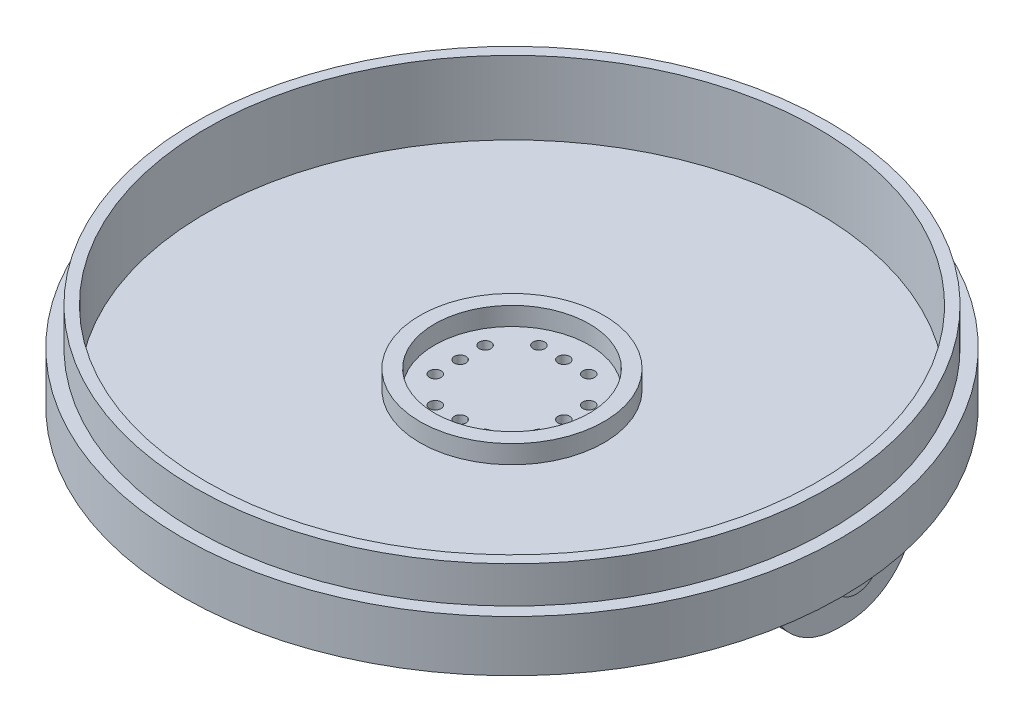
from build123d import *

# Parameters (mm, degrees)
CROQUIS2_R              = 45
SALIENTE_EXTRUIR1_DEPTH = 2
CROQUIS3_R              = 43.25
CROQUIS3_R_2            = 41.75
SALIENTE_EXTRUIR2_DEPTH = 10
CROQUIS4_R              = 45
CROQUIS4_R_2            = 43.25
SALIENTE_EXTRUIR3_DEPTH = 5
CROQUIS6_R              = 12.56
CROQUIS6_R_2            = 10.56
SALIENTE_EXTRUIR4_DEPTH = 2.5
CROQUIS7_R              = 0.8
CORTAR_EXTRUIR1_DEPTH   = 65.420493634
SALIENTE_EXTRUIR5_DEPTH = 6
CROQUIS10_R             = 1.45
SALIENTE_EXTRUIR6_DEPTH = 4
CROQUIS11_W             = 19.7
CROQUIS11_H             = 18.7
SALIENTE_EXTRUIR7_DEPTH = 2
CROQUIS12_R             = 3.151866764
SALIENTE_EXTRUIR8_DEPTH = 2.5
REDONDEO1_R             = 9.25
REDONDEO2_R             = 0.7
REDONDEO4_R             = 5


# Some blends are built 0.0001 mm under size
with BuildPart() as part:
    # Croquis2 → Saliente-Extruir1 (new body)
    with BuildSketch(Plane(origin=(0, 0, 0), x_dir=(1, 0, 0), z_dir=(0, 1, 0))):
        with Locations(Location((0, 0, 0), (0, 0, 270))):
            Circle(CROQUIS2_R)
    extrude(amount=SALIENTE_EXTRUIR1_DEPTH)

    # Croquis3 → Saliente-Extruir2 (add)
    with BuildSketch(Plane(origin=(0, 2, 0), x_dir=(1, 0, 0), z_dir=(0, 1, 0))):
        with Locations(Location((0, 0, 0), (0, 0, 270))):
            Circle(CROQUIS3_R)
        with Locations(Location((0, 0, 0), (0, 0, 270))):
            Circle(CROQUIS3_R_2, mode=Mode.SUBTRACT)
    extrude(amount=SALIENTE_EXTRUIR2_DEPTH)

    # Croquis4 → Saliente-Extruir3 (add)
    with BuildSketch(Plane(origin=(0, 2, 0), x_dir=(1, 0, 0), z_dir=(0, 1, 0))):
        with Locations(Location((0, 0, 0), (0, 0, 270))):
            Circle(CROQUIS4_R)
        with Locations(Location((0, 0, 0), (0, 0, 270))):
            Circle(CROQUIS4_R_2, mode=Mode.SUBTRACT)
    extrude(amount=SALIENTE_EXTRUIR3_DEPTH)

    # Croquis6 → Saliente-Extruir4 (add)
    with BuildSketch(Plane(origin=(0, 2, 0), x_dir=(1, 0, 0), z_dir=(0, 1, 0))):
        with Locations(Location((0, 0, 0), (0, 0, 270))):
            Circle(CROQUIS6_R)
        with Locations(Location((0, 0, 0), (0, 0, 270))):
            Circle(CROQUIS6_R_2, mode=Mode.SUBTRACT)
    extrude(amount=SALIENTE_EXTRUIR4_DEPTH)

    # Croquis7 → Cortar-Extruir1 (cut, through all)
    with BuildSketch(Plane(origin=(0, 2, 0), x_dir=(1, 0, 0), z_dir=(0, 1, 0))):
        with Locations(Location((0, 7.075, 0), (0, 0, 270))):
            Circle(CROQUIS7_R)
        with Locations(Location((3.4, 7.075, 0), (0, 0, 270))):
            Circle(CROQUIS7_R)
        with Locations(Location((-3.4, 7.075, 0), (0, 0, 90))):
            Circle(CROQUIS7_R)
        with Locations(Location((7.075, 3.4, 0), (0, 0, 90))):
            Circle(CROQUIS7_R)
        with Locations(Location((7.075, 0, 0), (0, 0, 270))):
            Circle(CROQUIS7_R)
        with Locations(Location((7.075, -3.4, 0), (0, 0, 270))):
            Circle(CROQUIS7_R)
        with Locations(Location((3.4, -7.075, 0), (0, 0, 90))):
            Circle(CROQUIS7_R)
        with Locations(Location((0, -7.075, 0), (0, 0, 270))):
            Circle(CROQUIS7_R)
        with Locations(Location((-3.4, -7.075, 0), (0, 0, 270))):
            Circle(CROQUIS7_R)
        with Locations(Location((-7.075, -3.4, 0), (0, 0, 90))):
            Circle(CROQUIS7_R)
        with Locations(Location((-7.075, 0, 0), (0, 0, 270))):
            Circle(CROQUIS7_R)
        with Locations(Location((-7.075, 3.4, 0), (0, 0, 270))):
            Circle(CROQUIS7_R)
    extrude(amount=-CORTAR_EXTRUIR1_DEPTH, mode=Mode.SUBTRACT)

    # Croquis8 → Saliente-Extruir5 (add)
    with BuildSketch(Plane.XZ):
        Polygon((-7.25, 9.05), (14.75, 9.05), (14.75, -30.45), (-7.25, -30.45), (-7.25, -39.45), (23.75, -39.45), (23.75, 18.05), (-7.25, 18.05), align=None)
    extrude(amount=SALIENTE_EXTRUIR5_DEPTH)

    # Croquis10 → Saliente-Extruir6 (add)
    # profile 1 of 2: a face of its own
    with BuildSketch(Plane.ZY.offset(7.25)):
        with BuildLine():
            Line((9.75, -24.7), (9.75, -6))
            Line((9.75, -6), (17.25, -6))
            Line((17.25, -6), (17.25, -21.25))
            ThreePointArc((17.25, -21.25), (16.239518395, -23.689518395), (13.8, -24.7))
            Line((13.8, -24.7), (9.75, -24.7))
        make_face()
        with Locations((13.8, -11.25)):
            Circle(CROQUIS10_R, mode=Mode.SUBTRACT)
        with Locations(Location((13.8, -21.25, 0), (0, 0, 180))):
            Circle(CROQUIS10_R, mode=Mode.SUBTRACT)
    # profile 2 of 2: a face of its own
    with BuildSketch(Plane.ZY.offset(7.25)):
        with BuildLine():
            Line((-31.15, -24.7), (-31.15, -6))
            Line((-31.15, -6), (-38.65, -6))
            Line((-38.65, -6), (-38.65, -21.25))
            ThreePointArc((-38.65, -21.25), (-37.639518395, -23.689518395), (-35.2, -24.7))
            Line((-35.2, -24.7), (-31.15, -24.7))
        make_face()
        with Locations((-35.2, -21.25)):
            Circle(CROQUIS10_R, mode=Mode.SUBTRACT)
        with Locations(Location((-35.2, -11.25, 0), (0, 0, 180))):
            Circle(CROQUIS10_R, mode=Mode.SUBTRACT)
    extrude(amount=-SALIENTE_EXTRUIR6_DEPTH)

    # Croquis11 → Saliente-Extruir7 (add)
    with BuildSketch(Plane(origin=(23.75, 0, 0), x_dir=(0, 0, -1), z_dir=(1, 0, 0))):
        with Locations((21.3, -15.35)):
            Rectangle(CROQUIS11_W, CROQUIS11_H)
    extrude(amount=-SALIENTE_EXTRUIR7_DEPTH)

    # Croquis12 → Saliente-Extruir8 (add)
    with BuildSketch(Plane(origin=(23.75, 0, 0), x_dir=(0, 0, -1), z_dir=(1, 0, 0))):
        with Locations(Location((20.77, -16.25, 0), (0, 0, 180))):
            Circle(CROQUIS12_R)
    extrude(amount=SALIENTE_EXTRUIR8_DEPTH)

    # Redondeo1
    # the kernel refuses this fillet: 9.25 mm, written as the material it adds along each edge
    with BuildSketch(Plane(origin=(23.75, -6, -31.15), x_dir=(0, 0, -1), z_dir=(-1, 0, 0))) as redondeo1_piece_1:
        with BuildLine():
            CenterArc((9.25, 9.201086892), REDONDEO1_R, 180, 84.1051745)
            Line((0, 9.201086892), (0, 0))
            Line((0, 0), (8.3, 0))
        make_face()
    extrude(amount=2)
    with BuildSketch(Plane(origin=(23.75, -6, -11.45), x_dir=(0, 0, 1), z_dir=(-1, 0, 0))) as redondeo1_piece_2:
        with BuildLine():
            CenterArc((REDONDEO1_R, -REDONDEO1_R), REDONDEO1_R, 90, 90)
            Line((0, -REDONDEO1_R), (0, 0))
            Line((0, 0), (REDONDEO1_R, 0))
        make_face()
    extrude(amount=2)
    # the kernel refuses this fillet: 9.25 mm, written as the material it takes off along each edge
    with BuildSketch(Plane(origin=(46.875, -24.7, -31.15), x_dir=(0, 0, 1), z_dir=(-1, 0, 0)), Plane(origin=(46.875, -24.7, -11.45), x_dir=(0, 1, 0), z_dir=(-1, 0, 0))) as redondeo1_2_piece_1:
        with BuildLine():
            CenterArc((REDONDEO1_R, REDONDEO1_R), REDONDEO1_R, 180, 90)
            Line((0, REDONDEO1_R), (0, 0))
            Line((0, 0), (REDONDEO1_R, 0))
        make_face()
    extrude(amount=48.25, mode=Mode.SUBTRACT)

    # Redondeo2
    redondeo2_edges = [part.edges().sort_by_distance(p)[0] for p in [
        (-3.25, -6, -34.9),
        (-5.25, -6, -38.65),
        (-5.25, -6, -31.15),
        (-3.25, -6, 13.5),
        (-5.25, -6, 9.75),
        (-5.25, -6, 17.25),
    ]]
    fillet(redondeo2_edges, radius=REDONDEO2_R - 0.0001)  # a hair under: the kernel refuses the full size

    # Redondeo4
    # the kernel refuses this fillet: 5 mm, written as the material it takes off along each edge
    with BuildSketch(Plane(origin=(23.75, 0, -39.45), x_dir=(0, 0, 1), z_dir=(0, -1, 0))) as redondeo4_piece_1:
        with BuildLine():
            CenterArc((REDONDEO4_R, REDONDEO4_R), REDONDEO4_R, 180, 90)
            Line((0, REDONDEO4_R), (0, 0))
            Line((0, 0), (REDONDEO4_R, 0))
        make_face()
    extrude(amount=18.5, mode=Mode.SUBTRACT)


solid = part.part
